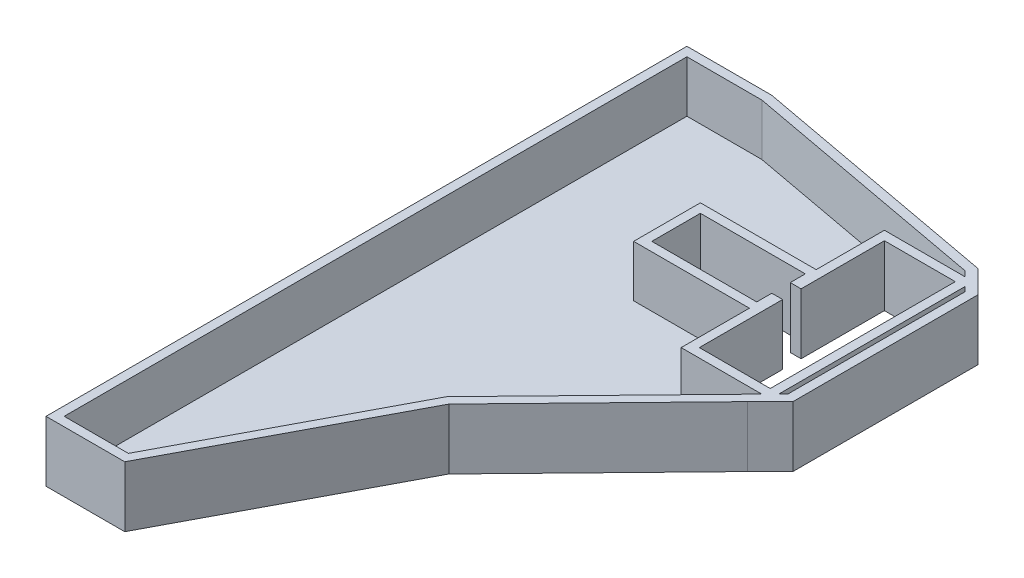
from build123d import *

# Parameters (mm, degrees)
BOSS_EXTRUDE2_DEPTH = 20
SHELL1_START        = 3
SHELL1_DEPTH        = 17


# Read off the part's stored shape, not the designer's step: Shell1
with BuildPart() as part:
    # Sketch1 → Boss-Extrude2 (new body)
    with BuildSketch(Plane(origin=(0, 0, 0), x_dir=(1, 0, 0), z_dir=(0, 1, 0))):
        Polygon((111.6, 38.05), (28, 53.55), (0, 53.55), (0, -158.05), (26, -158.05), (63, -88.05), (111.6, -38.05), (119.1, -30.55), (119.1, 30.55), align=None)
        Polygon((84.62, 3.05), (84.62, 8.02), (49.98, 8.02), (49.98, -8.02), (84.62, -8.02), (84.62, -3.05), (88.2, -3.05), (88.2, -30.55), (111.6, -30.55), (111.6, 30.55), (88.2, 30.55), (88.2, 3.05), align=None, mode=Mode.SUBTRACT)
    extrude(amount=BOSS_EXTRUDE2_DEPTH)

    # Shell1 outline → Shell1 (cut)
    with BuildSketch(Plane(origin=(0, 0, 0), x_dir=(1, 0, 0), z_dir=(0, 1, 0)).offset(SHELL1_START)):
        Polygon((114.6, -30.807359313), (116.1, -29.307359313), (116.1, 29.307359313), (114.6, 30.807359313), align=None)
        Polygon((109.463620332, -35.943738981), (111.857359313, -33.55), (85.2, -33.55), (85.2, -11.02), (46.98, -11.02), (46.98, 11.02), (85.2, 11.02), (85.2, 33.55), (111.857359313, 33.55), (110.13729107, 35.270068243), (27.724239787, 50.55), (3, 50.55), (3, -155.05), (24.192413563, -155.05), (60.548822095, -86.26760548), align=None)
    extrude(amount=SHELL1_DEPTH, mode=Mode.SUBTRACT)


solid = part.part
